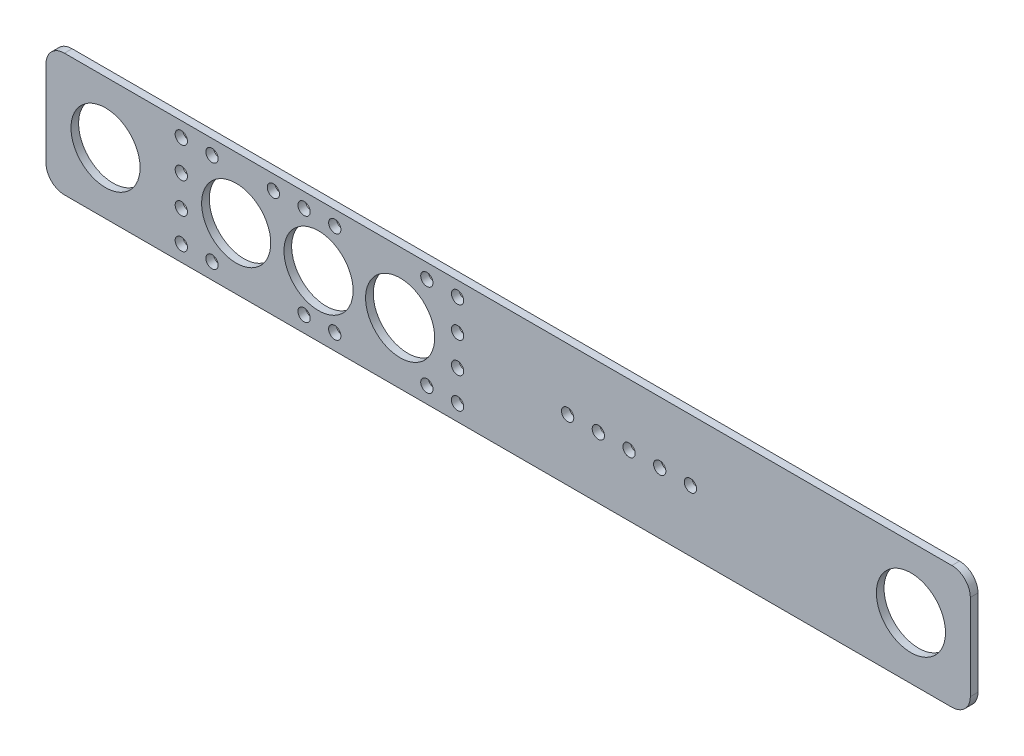
from build123d import *

# Parameters (mm, degrees)
SKETCH1_W           = 382.452818204
SKETCH1_H           = 50.8
SKETCH1_R           = 14.3002
SKETCH1_R_2         = 2.54
BOSS_EXTRUDE1_DEPTH = 3.175
FILLET1_R           = 7.62


with BuildPart() as part:
    # Sketch1 → Boss-Extrude1 (new body)
    with BuildSketch(Plane.XY):
        with Locations((132.2654537, 9.352736133)):
            Rectangle(SKETCH1_W, SKETCH1_H)
        with Locations((-34.334788468, 9.352736133)):
            Circle(SKETCH1_R, mode=Mode.SUBTRACT)
        with Locations((298.913211532, 9.352736133)):
            Circle(SKETCH1_R, mode=Mode.SUBTRACT)
        with Locations((53.803211532, 9.352736133)):
            Circle(SKETCH1_R, mode=Mode.SUBTRACT)
        with Locations((87.573397818, 9.352736133)):
            Circle(SKETCH1_R, mode=Mode.SUBTRACT)
        with Locations((19.729570927, 9.352736133)):
            Circle(SKETCH1_R, mode=Mode.SUBTRACT)
        with Locations((98.619809052, -9.430651268)):
            Circle(SKETCH1_R_2, mode=Mode.SUBTRACT)
        with Locations((111.319809052, -9.430651268)):
            Circle(SKETCH1_R_2, mode=Mode.SUBTRACT)
        with Locations((111.319809052, 3.269348732)):
            Circle(SKETCH1_R_2, mode=Mode.SUBTRACT)
        with Locations((111.319809052, 15.969348732)):
            Circle(SKETCH1_R_2, mode=Mode.SUBTRACT)
        with Locations((111.319809052, 28.669348732)):
            Circle(SKETCH1_R_2, mode=Mode.SUBTRACT)
        with Locations((98.619809052, 28.669348732)):
            Circle(SKETCH1_R_2, mode=Mode.SUBTRACT)
        with Locations((47.819809052, -9.430651268)):
            Circle(SKETCH1_R_2, mode=Mode.SUBTRACT)
        with Locations((60.519809052, -9.430651268)):
            Circle(SKETCH1_R_2, mode=Mode.SUBTRACT)
        with Locations((47.819809052, 28.669348732)):
            Circle(SKETCH1_R_2, mode=Mode.SUBTRACT)
        with Locations((60.519809052, 28.669348732)):
            Circle(SKETCH1_R_2, mode=Mode.SUBTRACT)
        with Locations((35.119809052, 28.669348732)):
            Circle(SKETCH1_R_2, mode=Mode.SUBTRACT)
        with Locations((9.719809052, -9.430651268)):
            Circle(SKETCH1_R_2, mode=Mode.SUBTRACT)
        with Locations((-2.980190948, -9.430651268)):
            Circle(SKETCH1_R_2, mode=Mode.SUBTRACT)
        with Locations((-2.980190948, 3.269348732)):
            Circle(SKETCH1_R_2, mode=Mode.SUBTRACT)
        with Locations((-2.980190948, 15.969348732)):
            Circle(SKETCH1_R_2, mode=Mode.SUBTRACT)
        with Locations((9.719809052, 28.669348732)):
            Circle(SKETCH1_R_2, mode=Mode.SUBTRACT)
        with Locations((-2.980190948, 28.669348732)):
            Circle(SKETCH1_R_2, mode=Mode.SUBTRACT)
        with Locations((156.877176863, 9.352736133)):
            Circle(SKETCH1_R_2, mode=Mode.SUBTRACT)
        with Locations((169.577176863, 9.352736133)):
            Circle(SKETCH1_R_2, mode=Mode.SUBTRACT)
        with Locations((182.277176863, 9.352736133)):
            Circle(SKETCH1_R_2, mode=Mode.SUBTRACT)
        with Locations((194.977176863, 9.352736133)):
            Circle(SKETCH1_R_2, mode=Mode.SUBTRACT)
        with Locations((207.677176863, 9.352736133)):
            Circle(SKETCH1_R_2, mode=Mode.SUBTRACT)
    extrude(amount=BOSS_EXTRUDE1_DEPTH)

    # Fillet1
    fillet1_edges = [part.edges().sort_by_distance(p)[0] for p in [
        (323.491862802, 34.752736133, 1.5875),
        (323.491862802, -16.047263867, 1.5875),
        (-58.960955402, -16.047263867, 1.5875),
        (-58.960955402, 34.752736133, 1.5875),
    ]]
    fillet(fillet1_edges, radius=FILLET1_R)


solid = part.part
